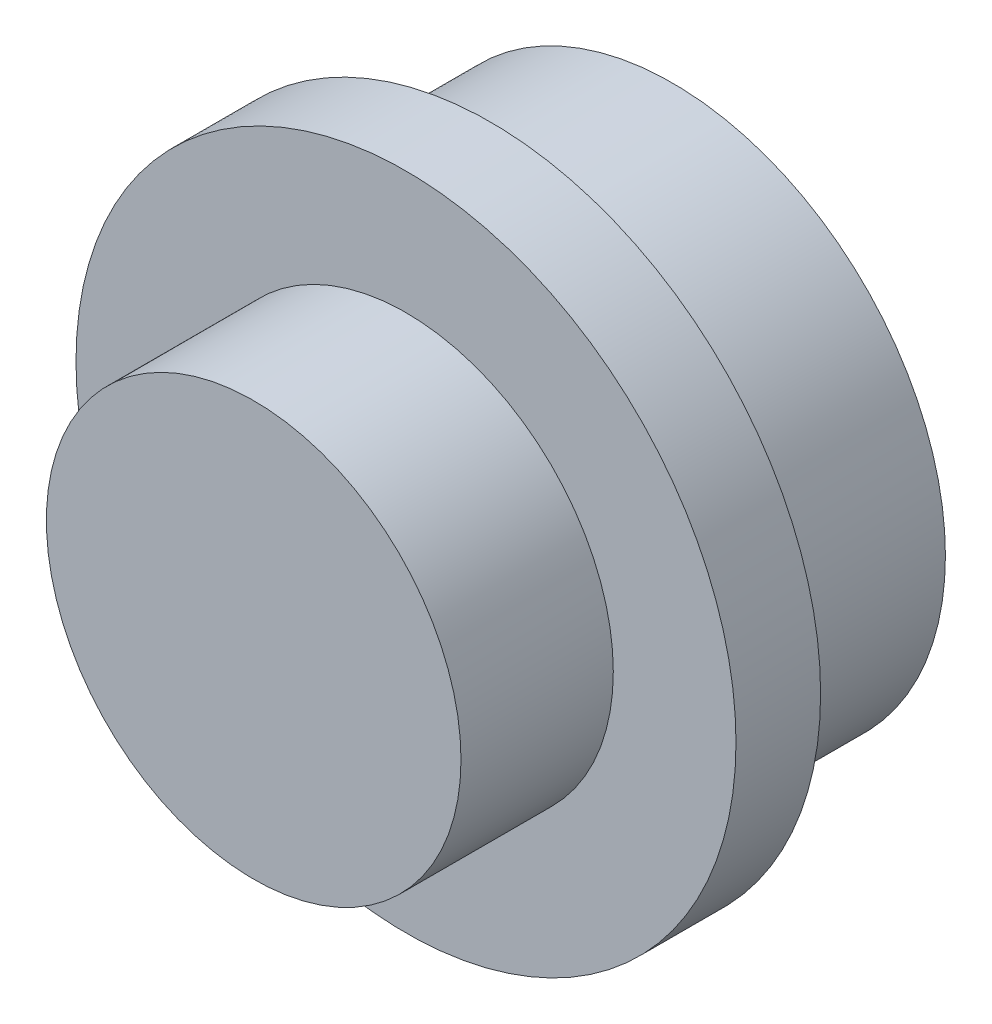
from build123d import *

# Parameters (mm, degrees)
SKETCH1_R           = 3.9
BOSS_EXTRUDE1_DEPTH = 1
SKETCH2_R           = 2.45
BOSS_EXTRUDE2_DEPTH = 1.8
SHELL1_START        = -1
SHELL1_OUTLINE_R    = 0.95
SHELL1_DEPTH        = 1.3
SKETCH3_R           = 3.225
SKETCH3_R_2         = 2.345
BOSS_EXTRUDE3_DEPTH = 2.15


# Read off the part's stored shape, not the designer's step: Shell1
with BuildPart() as part:
    # Sketch1 → Boss-Extrude1 (new body)
    with BuildSketch(Plane.XY):
        Circle(SKETCH1_R)
    extrude(amount=-BOSS_EXTRUDE1_DEPTH)

    # Sketch2 → Boss-Extrude2 (add)
    with BuildSketch(Plane.XY):
        Circle(SKETCH2_R)
    extrude(amount=BOSS_EXTRUDE2_DEPTH)

    # Shell1 outline → Shell1 (cut)
    with BuildSketch(Plane.XY.offset(SHELL1_START)):
        Circle(SHELL1_OUTLINE_R)
    extrude(amount=SHELL1_DEPTH, mode=Mode.SUBTRACT)

    # Sketch3 → Boss-Extrude3 (add)
    with BuildSketch(Plane(origin=(0, 0, -1), x_dir=(-1, 0, 0), z_dir=(0, 0, -1))):
        with Locations(Location((0, 0, 0), (0, 0, 180))):
            Circle(SKETCH3_R)
        with Locations(Location((0, 0, 0), (0, 0, 180))):
            Circle(SKETCH3_R_2, mode=Mode.SUBTRACT)
    extrude(amount=BOSS_EXTRUDE3_DEPTH)


solid = part.part
